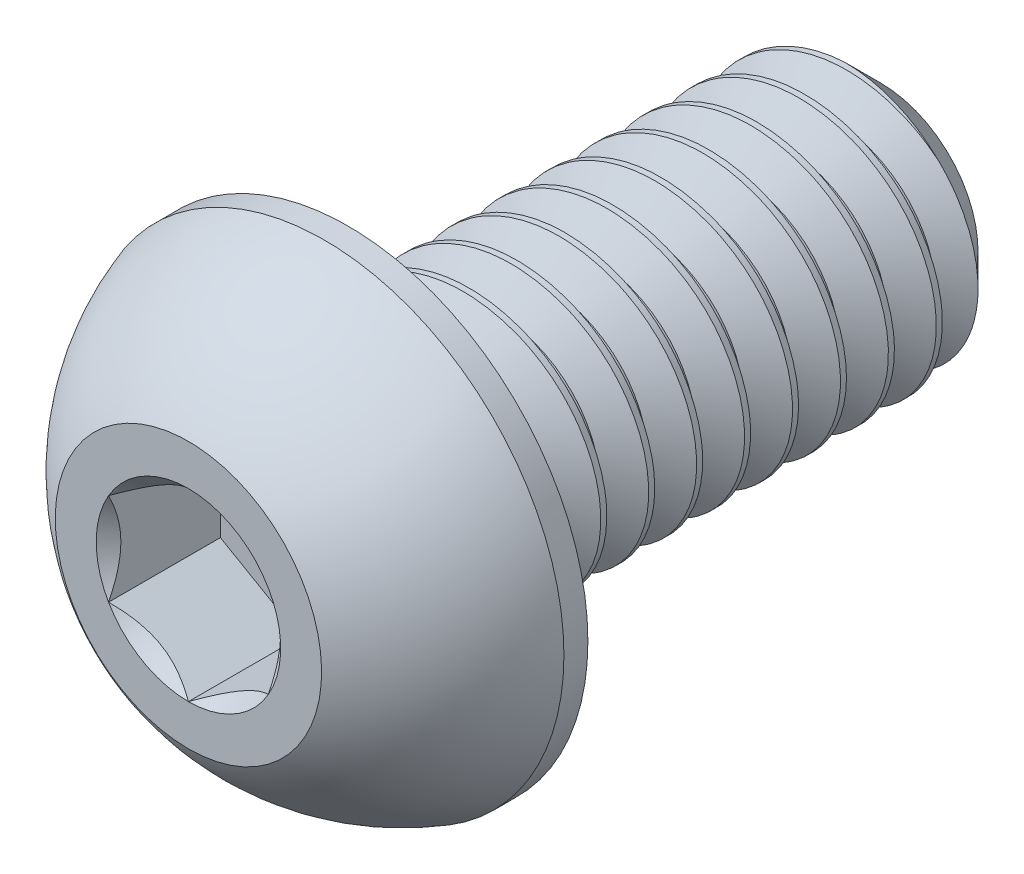
from build123d import *

# Parameters (mm, degrees)
SKETCH1_W          = 5
SKETCH1_H          = 1.25
CHAMFER1_SIZE      = 0.3375
CUT_EXTRUDE2_DEPTH = 1.05
CUT_SWEEP1_PITCH   = 0.45


with BuildPart() as part:
    # Sketch1 → Revolve1 (revolve)
    with BuildSketch(Plane(origin=(0, 0, 0), x_dir=(0, 0, -1), z_dir=(1, 0, 0))):
        with Locations((4, 0.625)):
            Rectangle(SKETCH1_W, SKETCH1_H)
    revolve(axis=Axis((0, 0, -6.5), (0, 0, 1)))

    # Chamfer1
    chamfer1_edges = [part.edges().sort_by_distance(p)[0] for p in [
        (0, -1.25, -6.5),
    ]]
    chamfer(chamfer1_edges, length=CHAMFER1_SIZE)

    # Sketch7 → Revolve2 (revolve)
    with BuildSketch(Plane(origin=(0, 0, 0), x_dir=(0, 0, -1), z_dir=(1, 0, 0)), mode=Mode.PRIVATE) as revolve2_sk:
        with BuildLine():
            Line((1.275, 2.25), (1.5, 2.25))
            Line((1.5, 2.25), (1.5, 0))
            Line((1.5, 0), (0, 0))
            Line((0, 0), (0, 1.25))
            ThreePointArc((0, 1.25), (0.549264706, 1.8625), (1.275, 2.25))
        make_face()
    revolve(revolve2_sk.sketch.rotate(Axis((0, 0, 0), (0, 0, -1)), 180), axis=Axis((0, 0, 0), (0, 0, -1)))

    # Sketch5 → Cut-Extrude2 (cut)
    with BuildSketch(Plane.XY):
        Polygon((0.75, -0.433012702), (0.75, 0.433012702), (0, 0.866025404), (-0.75, 0.433012702), (-0.75, -0.433012702), (0, -0.866025404), align=None)
    extrude(amount=-CUT_EXTRUDE2_DEPTH, mode=Mode.SUBTRACT)

    # Cut-Extrude3 cone 1 section (through the dimple's axis) → Cut-Extrude3 (revolve, cut)
    with BuildSketch(Plane(origin=(0, 0, 0), x_dir=(0, -1, 0), z_dir=(1, 0, 0))):
        Polygon((0, 0), (0.866025404, 0), (0, 0.866025404), align=None)
    revolve(axis=Axis((0, 0, 0), (0, 0, -1)), mode=Mode.SUBTRACT)

    # Cut-Sweep1: the profile of Sketch2 profile screwed along a right-hand helix of 12.111111 turns, 6 arcs to a turn; built about Z, then put on its axis
    cut_sweep1_z = Axis((0, 0, 0), (0, 0, 1))
    cut_sweep1_corners = [(1.2503, 0, 0.337673205), (1.2503, 0, -0.056423205), (0.957716426, 0, 0.1125), (0.957716426, 0, 0.16875)]
    with BuildLine(mode=Mode.PRIVATE) as cut_sweep1_profile:
        Line(cut_sweep1_corners[0], cut_sweep1_corners[1])
        Line(cut_sweep1_corners[1], cut_sweep1_corners[2])
        Line(cut_sweep1_corners[2], cut_sweep1_corners[3])
        Line(cut_sweep1_corners[3], cut_sweep1_corners[0])
    cut_sweep1_cap = Face(cut_sweep1_profile.wire())
    cut_sweep1_turn_angles = [0, 30, 60, 90, 120, 150, 180, 210, 240, 270, 300, 330, 360]
    cut_sweep1_turn_weights = [1, 0.8660254037844387, 1, 0.8660254037844387, 1, 0.8660254037844387, 1, 0.8660254037844387, 1, 0.8660254037844387, 1, 0.8660254037844387, 1]
    cut_sweep1_turn_rails = [Edge.make_bspline([Vector(p[0], p[1], 0).rotate(cut_sweep1_z, cut_sweep1_turn_angles[k]) / cut_sweep1_turn_weights[k] + Vector(0, 0, p[2] + CUT_SWEEP1_PITCH * cut_sweep1_turn_angles[k] / 360) for k in range(13)], [0, 0, 0, 1, 1, 2, 2, 3, 3, 4, 4, 5, 5, 6, 6, 6], 2, cut_sweep1_turn_weights) for p in cut_sweep1_corners]
    cut_sweep1_turn_sides = [Face.make_surface_from_curves(cut_sweep1_turn_rails[p[0]], cut_sweep1_turn_rails[p[1]]) for p in [(0, 1), (1, 2), (2, 3), (3, 0)]]
    cut_sweep1_last_angles = [4320, 4340, 4360]
    cut_sweep1_last_weights = [1, 0.939692620785903, 1]
    cut_sweep1_last_rails = [Edge.make_bspline([Vector(p[0], p[1], 0).rotate(cut_sweep1_z, cut_sweep1_last_angles[k]) / cut_sweep1_last_weights[k] + Vector(0, 0, p[2] + CUT_SWEEP1_PITCH * cut_sweep1_last_angles[k] / 360) for k in range(3)], [0, 0, 0, 1, 1, 1], 2, cut_sweep1_last_weights) for p in cut_sweep1_corners]
    cut_sweep1_last_sides = [Face.make_surface_from_curves(cut_sweep1_last_rails[p[0]], cut_sweep1_last_rails[p[1]]) for p in [(0, 1), (1, 2), (2, 3), (3, 0)]]
    cut_sweep1 = Plane(origin=(0, 0, -6.5), x_dir=(0, 1, 0), z_dir=(0, 0, 1)) * Solid(Shell([*[p.moved(Location((0, 0, CUT_SWEEP1_PITCH * i))) for i in range(12) for p in cut_sweep1_turn_sides], *cut_sweep1_last_sides, cut_sweep1_cap, cut_sweep1_cap.rotate(cut_sweep1_z, 4360).moved(Location((0, 0, CUT_SWEEP1_PITCH * 4360 / 360)))]))
    add(cut_sweep1, mode=Mode.SUBTRACT)


solid = part.part
